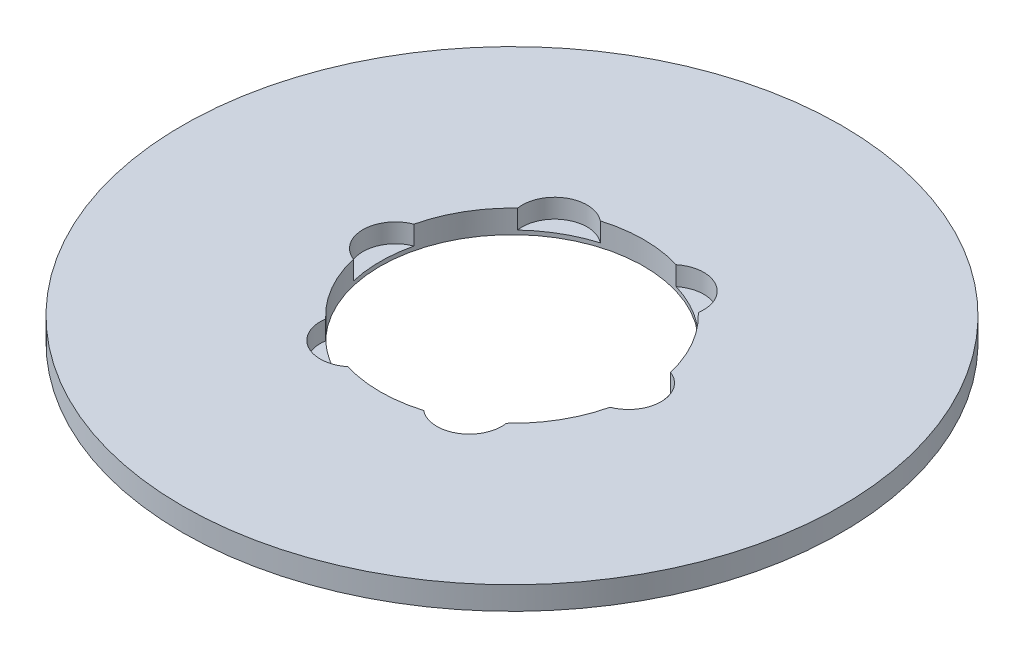
from build123d import *

# Parameters (mm, degrees)
SKETCH1_R           = 100
BOSS_EXTRUDE1_DEPTH = 7
SKETCH2_R           = 40
CUT_EXTRUDE1_DEPTH  = 142.594491418
SKETCH3_R           = 9.846356897
CUT_EXTRUDE2_DEPTH  = 5.764512728
CIRPATTERN1_COUNT   = 6


with BuildPart() as part:
    # Sketch1 → Boss-Extrude1 (new body)
    with BuildSketch(Plane(origin=(0, 0, 0), x_dir=(1, 0, 0), z_dir=(0, 1, 0))):
        Circle(SKETCH1_R)
    extrude(amount=BOSS_EXTRUDE1_DEPTH)

    # Sketch2 → Cut-Extrude1 (cut, through all)
    with BuildSketch(Plane(origin=(0, 0, 0), x_dir=(1, 0, 0), z_dir=(0, 1, 0))):
        Circle(SKETCH2_R)
    extrude(amount=CUT_EXTRUDE1_DEPTH, mode=Mode.SUBTRACT)

    # Sketch3 → Cut-Extrude2 (cut)
    with BuildSketch(Plane(origin=(0, 7, 0), x_dir=(1, 0, 0), z_dir=(0, 1, 0))):
        with Locations((-35.387577494, 0)):
            Circle(SKETCH3_R)
    cut_extrude2 = extrude(amount=-CUT_EXTRUDE2_DEPTH, mode=Mode.SUBTRACT)

    # CirPattern1: Cut-Extrude2 ×6 about axis
    cirpattern1_axis = Axis((0, 0, 0), (0, 1, 0))
    for i in range(1, CIRPATTERN1_COUNT):
        add(cut_extrude2.rotate(cirpattern1_axis, i * 360 / CIRPATTERN1_COUNT), mode=Mode.SUBTRACT)


solid = part.part
